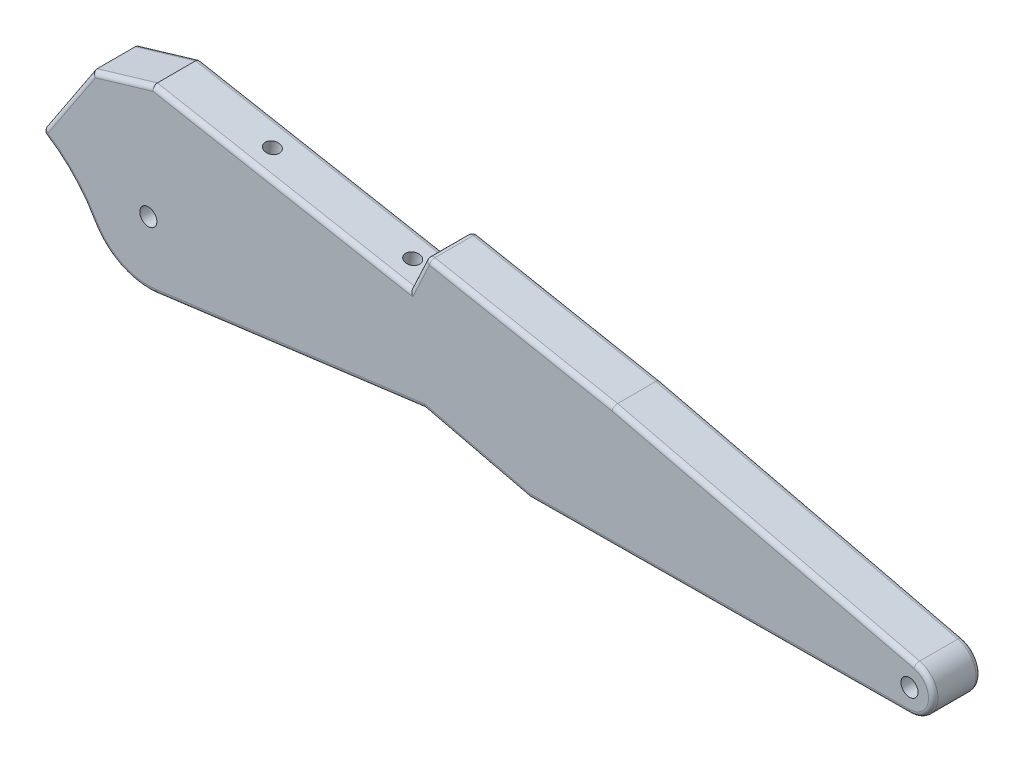
from build123d import *

# Parameters (mm, degrees)
SKETCH1_R           = 2.286
BOSS_EXTRUDE1_DEPTH = 12.7
FILLET1_R           = 1.27
SKETCH2_R           = 5.23875
CUT_EXTRUDE1_DEPTH  = 3.96875
SKETCH3_R           = 1.905
CUT_EXTRUDE2_DEPTH  = 12.7
SKETCH4_R           = 1.905
CUT_EXTRUDE3_DEPTH  = 12.7


with BuildPart() as part:
    # Sketch1 → Boss-Extrude1 (new body)
    with BuildSketch(Plane.XY):
        with BuildLine():
            Line((0.048604687, -6.34981398), (-101.551395313, -7.127511762))
            Line((-101.551395313, -7.127511762), (-129.54, -0.455968887))
            Line((-129.54, -0.455968887), (-200.976985186, -9.797318323))
            ThreePointArc((-200.976985186, -9.797318323), (-210.850504728, -8.14047549), (-218.115352674, -1.251825358))
            ThreePointArc((-218.115352674, -1.251825358), (-224.036255837, 6.613973279), (-231.775, 12.7))
            Line((-231.775, 12.7), (-218.115352674, 33.3375))
            Line((-218.115352674, 33.3375), (-202.035751798, 38.1))
            Line((-202.035751798, 38.1), (-133.35, 25.4))
            Line((-133.35, 25.4), (-128.905, 34.925))
            Line((-128.905, 34.925), (-79.17262462, 25.4))
            Line((-79.17262462, 25.4), (1.47237538, 6.17694186))
            ThreePointArc((1.47237538, 6.17694186), (6.309377787, -0.717113616), (0.048604687, -6.34981398))
        make_face()
        Circle(SKETCH1_R, mode=Mode.SUBTRACT)
        with Locations((-203.2, 7.20295315)):
            Circle(SKETCH1_R, mode=Mode.SUBTRACT)
    extrude(amount=BOSS_EXTRUDE1_DEPTH)

    # Fillet1
    fillet1_edges = [part.edges().sort_by_distance(p)[0] for p in [
        (-165.258492593, -5.126643605, 12.7),
        (-210.850504728, -8.14047549, 12.7),
        (-38.85012462, 15.78847093, 12.7),
        (-224.036255837, 6.613973279, 0),
        (-210.850504728, -8.14047549, 0),
        (-50.751395313, -6.738662871, 0),
        (-224.036255837, 6.613973279, 12.7),
        (-224.945176337, 23.01875, 12.7),
        (-210.075552236, 35.71875, 12.7),
        (-167.692875899, 31.75, 12.7),
        (-131.1275, 30.1625, 0),
        (-131.1275, 30.1625, 12.7),
        (-104.03881231, 30.1625, 12.7),
        (-115.545697656, -3.791740325, 12.7),
        (-50.751395313, -6.738662871, 12.7),
        (-210.075552236, 35.71875, 0),
        (-224.945176337, 23.01875, 0),
        (-167.692875899, 31.75, 0),
        (-128.905, 34.925, 6.35),
        (-165.258492593, -5.126643605, 0),
        (-115.545697656, -3.791740325, 0),
        (-38.85012462, 15.78847093, 0),
        (-104.03881231, 30.1625, 0),
        (6.309377787, -0.717113616, 12.7),
        (6.309377787, -0.717113616, 0),
        (-231.775, 12.7, 6.35),
    ]]
    fillet(fillet1_edges, radius=FILLET1_R)

    # Sketch2 → Cut-Extrude1 (cut)
    with BuildSketch(Plane(origin=(0, 0, 0), x_dir=(-1, 0, 0), z_dir=(0, 0, -1))):
        Circle(SKETCH2_R)
    extrude(amount=-CUT_EXTRUDE1_DEPTH, mode=Mode.SUBTRACT)

    # Sketch3 → Cut-Extrude2 (cut)
    with BuildSketch(Plane(origin=(0.132942268, 0.718995244, 0), x_dir=(0.9833321660356336, -0.18181818181818188, 0), z_dir=(0.18181818181818188, 0.9833321660356336, 0))):
        with Locations((-179.556061292, -6.35)):
            Circle(SKETCH3_R)
        with Locations((-141.456061292, -6.35)):
            Circle(SKETCH3_R)
    extrude(amount=-CUT_EXTRUDE2_DEPTH, mode=Mode.SUBTRACT)

    # Sketch4 → Cut-Extrude3 (cut)
    with BuildSketch(Plane(origin=(-167.013671414, 110.543808611, 0), x_dir=(0, 0, 1), z_dir=(-0.8338861185572083, 0.5519365373642097, 0))):
        with Locations((6.35, -110.945024644)):
            Circle(SKETCH4_R)
    extrude(amount=-CUT_EXTRUDE3_DEPTH, mode=Mode.SUBTRACT)


solid = part.part
